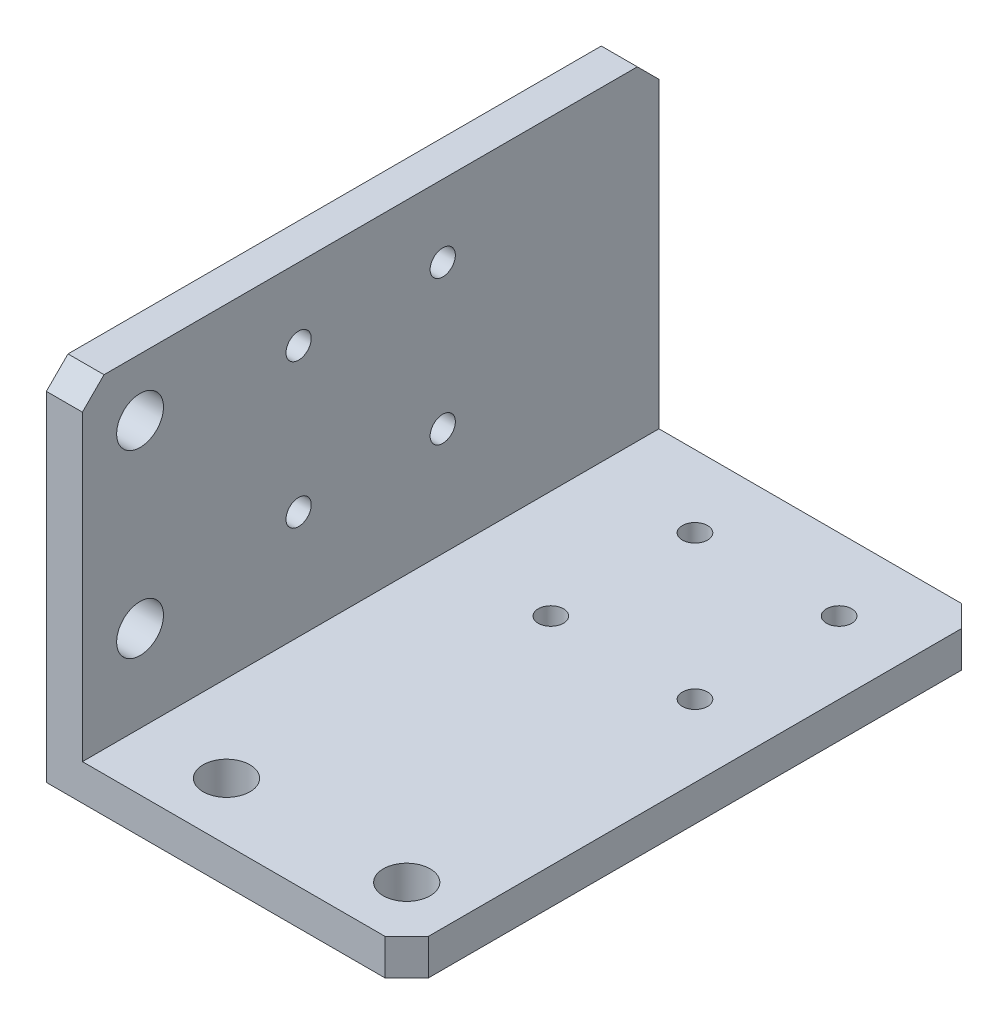
from build123d import *

# Parameters (mm, degrees)
ESTRUSIONE_ESTRUSIONE1_DEPTH = 80
FORO_6_5_6_5_1_D             = 6.5
FORO_6_5_6_5_2_D             = 6.5
FORO_6_5_6_5_2_DEPTH         = 5
FORO_6_5_6_5_2_TIP           = 1.952797012
TAGLIO_ESTRUSIONE1_REACH     = 108.771
SCHIZZO8_R                   = 1.75
TAGLIO_ESTRUSIONE2_REACH     = 108.771
SCHIZZO9_R                   = 1.75
SMUSSO1_SIZE                 = 3


with BuildPart() as part:
    # Schizzo1 → Estrusione-Estrusione1 (new body)
    with BuildSketch(Plane.XY):
        Polygon((0, 0), (0, 50), (5, 50), (5, 5), (50, 5), (50, 0), align=None)
    extrude(amount=ESTRUSIONE_ESTRUSIONE1_DEPTH)

    # Foro Ø6.5 (6.5)-1 (through all)
    with Locations(Plane(origin=(0, 0, 0), x_dir=(-1, 0, 0), z_dir=(0, -1, 0))):
        with Locations((-17, -72), (-42, -72)):
            Hole(FORO_6_5_6_5_1_D / 2)

    # Foro Ø6.5 (6.5)-2
    with Locations(Plane.ZY):
        with Locations((72, 42), (72, 17)):
            Hole(FORO_6_5_6_5_2_D / 2, depth=FORO_6_5_6_5_2_DEPTH)
            with Locations((0, 0, -(FORO_6_5_6_5_2_DEPTH + FORO_6_5_6_5_2_TIP / 2))):  # 118° drill point
                Cone(0, FORO_6_5_6_5_2_D / 2, FORO_6_5_6_5_2_TIP, mode=Mode.SUBTRACT)

    # Schizzo8 → Taglio-Estrusione1 (cut, up to next)
    with BuildSketch(Plane.XZ, mode=Mode.PRIVATE) as taglio_estrusione1_sk1:
        with Locations((20, 10)):
            Circle(SCHIZZO8_R)
    taglio_estrusione1_tool1 = extrude(taglio_estrusione1_sk1.sketch, amount=-TAGLIO_ESTRUSIONE1_REACH, mode=Mode.PRIVATE) & part.part
    # Schizzo8 → Taglio-Estrusione1 (cut, up to next)
    with BuildSketch(Plane.XZ, mode=Mode.PRIVATE) as taglio_estrusione1_sk2:
        with Locations((20, 30)):
            Circle(SCHIZZO8_R)
    taglio_estrusione1_tool2 = extrude(taglio_estrusione1_sk2.sketch, amount=-TAGLIO_ESTRUSIONE1_REACH, mode=Mode.PRIVATE) & part.part
    # Schizzo8 → Taglio-Estrusione1 (cut, up to next)
    with BuildSketch(Plane.XZ, mode=Mode.PRIVATE) as taglio_estrusione1_sk3:
        with Locations((40, 30)):
            Circle(SCHIZZO8_R)
    taglio_estrusione1_tool3 = extrude(taglio_estrusione1_sk3.sketch, amount=-TAGLIO_ESTRUSIONE1_REACH, mode=Mode.PRIVATE) & part.part
    # Schizzo8 → Taglio-Estrusione1 (cut, up to next)
    with BuildSketch(Plane.XZ, mode=Mode.PRIVATE) as taglio_estrusione1_sk4:
        with Locations((40, 10)):
            Circle(SCHIZZO8_R)
    taglio_estrusione1_tool4 = extrude(taglio_estrusione1_sk4.sketch, amount=-TAGLIO_ESTRUSIONE1_REACH, mode=Mode.PRIVATE) & part.part
    add(taglio_estrusione1_tool1.solids().sort_by_distance((20, 0, 10))[0], mode=Mode.SUBTRACT)
    add(taglio_estrusione1_tool2.solids().sort_by_distance((20, 0, 30))[0], mode=Mode.SUBTRACT)
    add(taglio_estrusione1_tool3.solids().sort_by_distance((40, 0, 30))[0], mode=Mode.SUBTRACT)
    add(taglio_estrusione1_tool4.solids().sort_by_distance((40, 0, 10))[0], mode=Mode.SUBTRACT)

    # Schizzo9 → Taglio-Estrusione2 (cut, up to next)
    with BuildSketch(Plane.ZY, mode=Mode.PRIVATE) as taglio_estrusione2_sk1:
        with Locations((30, 40)):
            Circle(SCHIZZO9_R)
    taglio_estrusione2_tool1 = extrude(taglio_estrusione2_sk1.sketch, amount=-TAGLIO_ESTRUSIONE2_REACH, mode=Mode.PRIVATE) & part.part
    # Schizzo9 → Taglio-Estrusione2 (cut, up to next)
    with BuildSketch(Plane.ZY, mode=Mode.PRIVATE) as taglio_estrusione2_sk2:
        with Locations((50, 40)):
            Circle(SCHIZZO9_R)
    taglio_estrusione2_tool2 = extrude(taglio_estrusione2_sk2.sketch, amount=-TAGLIO_ESTRUSIONE2_REACH, mode=Mode.PRIVATE) & part.part
    # Schizzo9 → Taglio-Estrusione2 (cut, up to next)
    with BuildSketch(Plane.ZY, mode=Mode.PRIVATE) as taglio_estrusione2_sk3:
        with Locations((50, 20)):
            Circle(SCHIZZO9_R)
    taglio_estrusione2_tool3 = extrude(taglio_estrusione2_sk3.sketch, amount=-TAGLIO_ESTRUSIONE2_REACH, mode=Mode.PRIVATE) & part.part
    # Schizzo9 → Taglio-Estrusione2 (cut, up to next)
    with BuildSketch(Plane.ZY, mode=Mode.PRIVATE) as taglio_estrusione2_sk4:
        with Locations((30, 20)):
            Circle(SCHIZZO9_R)
    taglio_estrusione2_tool4 = extrude(taglio_estrusione2_sk4.sketch, amount=-TAGLIO_ESTRUSIONE2_REACH, mode=Mode.PRIVATE) & part.part
    add(taglio_estrusione2_tool1.solids().sort_by_distance((0, 40, 30))[0], mode=Mode.SUBTRACT)
    add(taglio_estrusione2_tool2.solids().sort_by_distance((0, 40, 50))[0], mode=Mode.SUBTRACT)
    add(taglio_estrusione2_tool3.solids().sort_by_distance((0, 20, 50))[0], mode=Mode.SUBTRACT)
    add(taglio_estrusione2_tool4.solids().sort_by_distance((0, 20, 30))[0], mode=Mode.SUBTRACT)

    # Smusso1
    smusso1_edges = [part.edges().sort_by_distance(p)[0] for p in [
        (2.5, 50, 0),
        (50, 2.5, 0),
        (50, 2.5, 80),
        (2.5, 50, 80),
    ]]
    chamfer(smusso1_edges, length=SMUSSO1_SIZE)


solid = part.part
